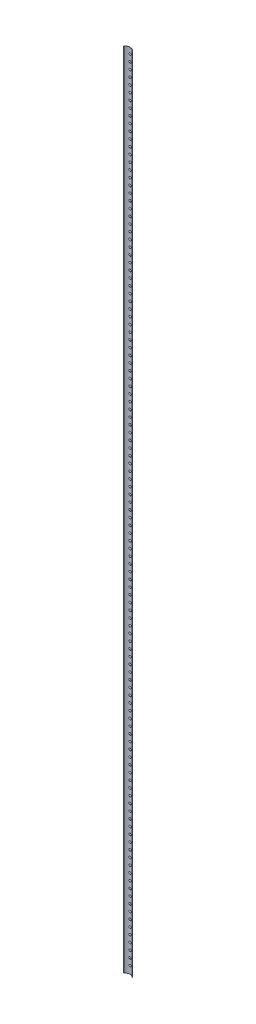
from build123d import *

# Parameters (mm, degrees)
BOSS_EXTRUDE1_DEPTH = 2743.2
SKETCH4_R           = 3.81
CUT_EXTRUDE2_DEPTH  = 25.4
LPATTERN1_COUNT     = 120
LPATTERN1_PITCH     = 22.86


with BuildPart() as part:
    # Sketch2 → Boss-Extrude1 (new body)
    with BuildSketch(Plane(origin=(0, 0, 0), x_dir=(1, 0, 0), z_dir=(0, 1, 0))):
        with BuildLine():
            Line((-18.391681054, -0.131319119), (-18.021681054, -0.131319119))
            ThreePointArc((-18.021681054, -0.131319119), (-3.972183239, 7.366467371), (10.077314576, -0.131319119))
            Line((10.077314576, -0.131319119), (10.498318946, -0.131319119))
            ThreePointArc((10.498318946, -0.131319119), (-3.946681054, 7.688680881), (-18.391681054, -0.131319119))
        make_face()
    extrude(amount=BOSS_EXTRUDE1_DEPTH)

    # Sketch4 → Cut-Extrude2 (cut)
    with BuildSketch(Plane.XY.offset(0.131319119)):
        with Locations((-3.946681054, 25.4)):
            Circle(SKETCH4_R)
    cut_extrude2 = extrude(amount=-CUT_EXTRUDE2_DEPTH, mode=Mode.SUBTRACT)

    # LPattern1: Cut-Extrude2 ×120
    with Locations(*[(0, i * LPATTERN1_PITCH, 0) for i in range(1, LPATTERN1_COUNT)]):
        add(cut_extrude2, mode=Mode.SUBTRACT)


solid = part.part
